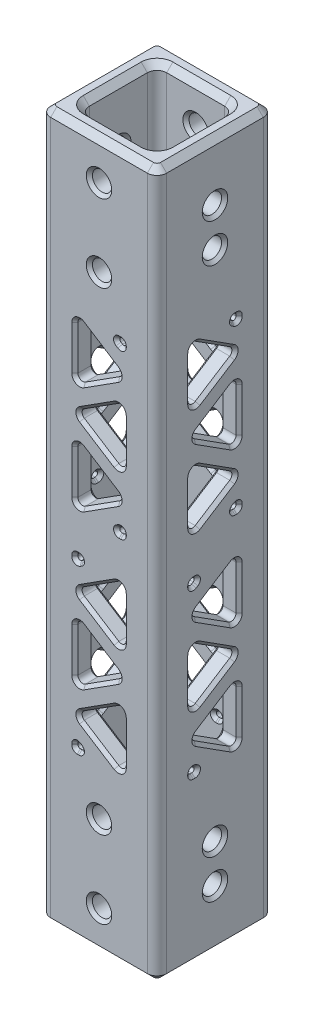
from build123d import *

# Parameters (mm, degrees)
SKETCH1_W                    = 19.05
SKETCH1_H                    = 19.05
SKETCH1_W_2                  = 12.7
SKETCH1_H_2                  = 12.7
BOSS_EXTRUDE1_DEPTH          = 57.94375
F_1_8_0_125_DIAMETER_HOLE1_D = 3.175
F_1_8_0_125_DIAMETER_HOLE2_D = 3.175
F_1_8_0_125_DIAMETER_HOLE3_D = 3.175
CUT_EXTRUDE1_DEPTH           = 60.488901604
CIRPATTERN2_COUNT            = 4
FILLET1_R                    = 1.5875
FILLET2_R                    = 0.79375
FILLET3_R                    = 0.396875
CHAMFER1_SIZE                = 1.016
CHAMFER2_SIZE                = 0.508


with BuildPart() as part:
    # Sketch1 → Boss-Extrude1 (new, symmetric)
    with BuildSketch(Plane(origin=(0, 0, 0), x_dir=(1, 0, 0), z_dir=(0, 1, 0))):
        Rectangle(SKETCH1_W, SKETCH1_H)
        Rectangle(SKETCH1_W_2, SKETCH1_H_2, mode=Mode.SUBTRACT)
    extrude(amount=BOSS_EXTRUDE1_DEPTH, both=True)

    # 1/8 (0.125) Diameter Hole1 (through all)
    with Locations(Plane(origin=(0, 0, 9.525), x_dir=(-1, 0, 0), z_dir=(0, 0, 1))):
        with Locations((0, -51.59375), (0, -38.89375), (0, 38.89375), (0, 51.59375)):
            Hole(F_1_8_0_125_DIAMETER_HOLE1_D / 2)

    # 1/8 (0.125) Diameter Hole2 (through all)
    with Locations(Plane.ZY.offset(9.525)):
        with Locations((0, 48.41875), (0, 42.06875)):
            Hole(F_1_8_0_125_DIAMETER_HOLE2_D / 2)

    # 1/8 (0.125) Diameter Hole3 (through all)
    with Locations(Plane(origin=(9.525, 0, 0), x_dir=(0, 0, -1), z_dir=(1, 0, 0))):
        with Locations((0, -42.06875), (0, -48.41875)):
            Hole(F_1_8_0_125_DIAMETER_HOLE3_D / 2)

    # Sketch14 → Cut-Extrude1 (cut, through all)
    with BuildSketch(Plane.XY):
        Polygon((-3.96875, 30.95625), (-1.935718061, 30.95625), (-3.96875, 29.659612075), align=None)
        Polygon((3.96875, 30.95625), (-3.96875, 25.893829025), (3.96875, 20.83140805), align=None)
        Polygon((-3.96875, 22.128045975), (3.96875, 17.065625), (-3.96875, 12.003204025), align=None)
        Polygon((3.96875, 13.29984195), (-3.96875, 8.237420975), (3.96875, 3.175), align=None)
        Polygon((-1.935718061, 3.175), (-3.96875, 3.175), (-3.96875, 4.471637925), align=None)
        Polygon((1.935718061, -3.175), (3.96875, -3.175), (3.96875, -4.471637925), align=None)
        Polygon((-3.96875, -3.175), (3.96875, -8.237420975), (-3.96875, -13.29984195), align=None)
        Polygon((3.96875, -12.003204025), (-3.96875, -17.065625), (3.96875, -22.128045975), align=None)
        Polygon((-3.96875, -30.95625), (3.96875, -25.893829025), (-3.96875, -20.83140805), align=None)
        Polygon((1.935718061, -30.95625), (3.96875, -30.95625), (3.96875, -29.659612075), align=None)
    cut_extrude1 = extrude(amount=-CUT_EXTRUDE1_DEPTH, mode=Mode.SUBTRACT)

    # CirPattern2: Cut-Extrude1 ×4 about axis
    cirpattern2_axis = Axis((0, 0, 0), (0, 1, 0))
    for i in range(1, CIRPATTERN2_COUNT):
        add(cut_extrude1.rotate(cirpattern2_axis, i * 360 / CIRPATTERN2_COUNT), mode=Mode.SUBTRACT)

    # Fillet1
    fillet1_edges = [part.edges().sort_by_distance(p)[0] for p in [
        (6.35, 0, 6.35),
        (6.35, 0, -6.35),
        (-6.35, 0, -6.35),
        (-6.35, 0, 6.35),
        (9.525, 0, 9.525),
        (-9.525, 0, 9.525),
        (-9.525, 0, -9.525),
        (9.525, 0, -9.525),
    ]]
    fillet(fillet1_edges, radius=FILLET1_R)

    # Fillet2
    fillet2_edges = [part.edges().sort_by_distance(p)[0] for p in [
        (3.96875, 30.95625, -7.9375),
        (3.96875, 20.83140805, -7.9375),
        (-3.96875, 25.893829025, -7.9375),
        (-3.96875, 12.003204025, -7.9375),
        (-3.96875, 22.128045975, -7.9375),
        (3.96875, 17.065625, -7.9375),
        (-3.96875, -13.29984195, -7.9375),
        (-3.96875, -3.175, -7.9375),
        (3.96875, -8.237420975, -7.9375),
        (3.96875, 13.29984195, -7.9375),
        (3.96875, 3.175, -7.9375),
        (-3.96875, 8.237420975, -7.9375),
        (-3.96875, -30.95625, -7.9375),
        (-3.96875, -20.83140805, -7.9375),
        (3.96875, -25.893829025, -7.9375),
        (3.96875, -12.003204025, -7.9375),
        (3.96875, -22.128045975, -7.9375),
        (-3.96875, -17.065625, -7.9375),
        (7.9375, -12.003204025, 3.96875),
        (-7.9375, -13.29984195, 3.96875),
        (7.9375, -13.29984195, -3.96875),
        (7.9375, -30.95625, -3.96875),
        (-7.9375, -12.003204025, -3.96875),
        (-7.9375, -30.95625, 3.96875),
        (7.9375, -22.128045975, 3.96875),
        (7.9375, -17.065625, -3.96875),
        (3.96875, -30.95625, 7.9375),
        (3.96875, -20.83140805, 7.9375),
        (-3.96875, -25.893829025, 7.9375),
        (3.96875, -13.29984195, 7.9375),
        (3.96875, -3.175, 7.9375),
        (-3.96875, -8.237420975, 7.9375),
        (7.9375, -20.83140805, -3.96875),
        (7.9375, -25.893829025, 3.96875),
        (7.9375, -3.175, -3.96875),
        (7.9375, -8.237420975, 3.96875),
        (-3.96875, -12.003204025, 7.9375),
        (-3.96875, -22.128045975, 7.9375),
        (3.96875, -17.065625, 7.9375),
        (-7.9375, -20.83140805, 3.96875),
        (-7.9375, -25.893829025, -3.96875),
        (-7.9375, -22.128045975, -3.96875),
        (-7.9375, -17.065625, 3.96875),
        (-7.9375, -3.175, 3.96875),
        (-7.9375, -8.237420975, -3.96875),
        (7.9375, 12.003204025, -3.96875),
        (-7.9375, 13.29984195, -3.96875),
        (7.9375, 13.29984195, 3.96875),
        (7.9375, 30.95625, 3.96875),
        (-7.9375, 30.95625, -3.96875),
        (-7.9375, 12.003204025, 3.96875),
        (7.9375, 3.175, 3.96875),
        (7.9375, 8.237420975, -3.96875),
        (-3.96875, 13.29984195, 7.9375),
        (-3.96875, 3.175, 7.9375),
        (3.96875, 8.237420975, 7.9375),
        (-3.96875, 30.95625, 7.9375),
        (-3.96875, 20.83140805, 7.9375),
        (3.96875, 25.893829025, 7.9375),
        (-7.9375, 20.83140805, -3.96875),
        (-7.9375, 25.893829025, 3.96875),
        (-7.9375, 22.128045975, 3.96875),
        (-7.9375, 17.065625, -3.96875),
        (3.96875, 12.003204025, 7.9375),
        (3.96875, 22.128045975, 7.9375),
        (-3.96875, 17.065625, 7.9375),
        (7.9375, 20.83140805, 3.96875),
        (7.9375, 25.893829025, -3.96875),
        (7.9375, 22.128045975, -3.96875),
        (7.9375, 17.065625, 3.96875),
        (-7.9375, 3.175, -3.96875),
        (-7.9375, 8.237420975, 3.96875),
    ]]
    fillet(fillet2_edges, radius=FILLET2_R)

    # Fillet3
    fillet3_edges = [part.edges().sort_by_distance(p)[0] for p in [
        (3.96875, -3.175, -7.9375),
        (3.96875, -4.471637925, -7.9375),
        (1.935718061, -3.175, -7.9375),
        (-3.96875, 3.175, -7.9375),
        (-3.96875, 4.471637925, -7.9375),
        (-1.935718061, 3.175, -7.9375),
        (3.96875, -29.659612075, -7.9375),
        (3.96875, -30.95625, -7.9375),
        (1.935718061, -30.95625, -7.9375),
        (-3.96875, 29.659612075, -7.9375),
        (-3.96875, 30.95625, -7.9375),
        (-1.935718061, 30.95625, -7.9375),
        (-7.9375, -29.659612075, -3.96875),
        (7.9375, -29.659612075, 3.96875),
        (7.9375, -30.95625, 1.935718061),
        (7.9375, -30.95625, 3.96875),
        (-7.9375, -3.175, -3.96875),
        (7.9375, -3.175, 3.96875),
        (7.9375, -4.471637925, 3.96875),
        (7.9375, -3.175, 1.935718061),
        (-7.9375, -4.471637925, -3.96875),
        (-7.9375, -3.175, -1.935718061),
        (-7.9375, -30.95625, -3.96875),
        (-7.9375, -30.95625, -1.935718061),
        (-3.96875, -3.175, 7.9375),
        (-3.96875, -4.471637925, 7.9375),
        (-1.935718061, -3.175, 7.9375),
        (-3.96875, -29.659612075, 7.9375),
        (-1.935718061, -30.95625, 7.9375),
        (-3.96875, -30.95625, 7.9375),
        (7.9375, 29.659612075, -3.96875),
        (7.9375, 3.175, -3.96875),
        (7.9375, 30.95625, -3.96875),
        (7.9375, 30.95625, -1.935718061),
        (3.96875, 3.175, 7.9375),
        (3.96875, 4.471637925, 7.9375),
        (1.935718061, 3.175, 7.9375),
        (-7.9375, 29.659612075, 3.96875),
        (-7.9375, 30.95625, 3.96875),
        (-7.9375, 30.95625, 1.935718061),
        (3.96875, 29.659612075, 7.9375),
        (3.96875, 30.95625, 7.9375),
        (1.935718061, 30.95625, 7.9375),
        (-7.9375, 3.175, 3.96875),
        (-7.9375, 4.471637925, 3.96875),
        (-7.9375, 3.175, 1.935718061),
        (7.9375, 4.471637925, -3.96875),
        (7.9375, 3.175, -1.935718061),
    ]]
    fillet(fillet3_edges, radius=FILLET3_R)

    # Chamfer1
    chamfer1_edges = [part.edges().sort_by_distance(p)[0] for p in [
        (0, -57.94375, -9.525),
        (0, 57.94375, -9.525),
        (9.525, -57.94375, 0),
        (0, -57.94375, 9.525),
        (-9.525, -57.94375, 0),
        (0, -57.94375, 6.35),
        (6.35, -57.94375, 0),
        (0, -57.94375, -6.35),
        (-6.35, -57.94375, 0),
        (-9.060032015, -57.94375, 9.060032015),
        (-9.060032015, -57.94375, -9.060032015),
        (9.060032015, -57.94375, 9.060032015),
        (9.060032015, -57.94375, -9.060032015),
        (9.525, 57.94375, 0),
        (-9.525, 57.94375, 0),
        (0, 57.94375, 9.525),
        (6.35, 57.94375, 0),
        (0, 57.94375, 6.35),
        (-6.35, 57.94375, 0),
        (0, 57.94375, -6.35),
        (-9.060032015, 57.94375, 9.060032015),
        (-9.060032015, 57.94375, -9.060032015),
        (9.060032015, 57.94375, 9.060032015),
        (9.060032015, 57.94375, -9.060032015),
        (5.885032015, -57.94375, -5.885032015),
        (5.885032015, 57.94375, -5.885032015),
        (5.885032015, -57.94375, 5.885032015),
        (5.885032015, 57.94375, 5.885032015),
        (-5.885032015, -57.94375, 5.885032015),
        (-5.885032015, 57.94375, 5.885032015),
        (-5.885032015, -57.94375, -5.885032015),
        (-5.885032015, 57.94375, -5.885032015),
    ]]
    chamfer(chamfer1_edges, length=CHAMFER1_SIZE)

    # Chamfer2
    chamfer2_edges = [part.edges().sort_by_distance(p)[0] for p in [
        (9.525, -12.548152991, -3.556607903),
        (6.35, 21.376357017, -3.556607903),
        (9.525, 21.376357017, -3.556607903),
        (6.35, 17.065625, 3.286382985),
        (9.525, 17.065625, 3.286382985),
        (6.35, 12.754892983, -3.556607903),
        (9.525, 12.754892983, -3.556607903),
        (6.35, 21.583097009, 3.556607903),
        (9.525, 21.583097009, 3.556607903),
        (6.35, 30.204561042, 3.556607903),
        (9.525, 30.204561042, 3.556607903),
        (6.35, 25.893829025, -3.286382985),
        (9.525, 25.893829025, -3.286382985),
        (3.556607903, -21.376357017, -6.35),
        (3.556607903, -21.376357017, -9.525),
        (-3.286382985, -17.065625, -6.35),
        (-3.286382985, -17.065625, -9.525),
        (3.556607903, -12.754892983, -6.35),
        (3.556607903, -12.754892983, -9.525),
        (-3.556607903, -21.583097009, -6.35),
        (-3.556607903, -21.583097009, -9.525),
        (3.286382985, -25.893829025, -6.35),
        (3.286382985, -25.893829025, -9.525),
        (-3.556607903, -30.204561042, -6.35),
        (-3.556607903, -30.204561042, -9.525),
        (3.556607903, 3.926688958, -6.35),
        (3.556607903, 3.926688958, -9.525),
        (-3.286382985, 8.237420975, -6.35),
        (-3.286382985, 8.237420975, -9.525),
        (3.556607903, 12.548152991, -6.35),
        (3.556607903, 12.548152991, -9.525),
        (-3.556607903, -3.926688958, -6.35),
        (-3.556607903, -3.926688958, -9.525),
        (3.286382985, -8.237420975, -6.35),
        (3.286382985, -8.237420975, -9.525),
        (-3.556607903, -12.548152991, -6.35),
        (-3.556607903, -12.548152991, -9.525),
        (-3.556607903, 21.376357017, -6.35),
        (-3.556607903, 21.376357017, -9.525),
        (3.286382985, 17.065625, -6.35),
        (3.286382985, 17.065625, -9.525),
        (-3.556607903, 12.754892983, -6.35),
        (-3.556607903, 12.754892983, -9.525),
        (3.556607903, 21.583097009, -6.35),
        (3.556607903, 21.583097009, -9.525),
        (3.556607903, 30.204561042, -6.35),
        (3.556607903, 30.204561042, -9.525),
        (-3.286382985, 25.893829025, -6.35),
        (-3.286382985, 25.893829025, -9.525),
        (-3.433961043, -30.95625, 6.35),
        (-3.433961043, -30.95625, 9.525),
        (-3.220550095, -30.136802991, 6.35),
        (-3.220550095, -30.136802991, 9.525),
        (-3.96875, -30.471415503, 6.35),
        (-3.96875, -30.471415503, 9.525),
        (-3.220550095, -3.994447009, 6.35),
        (-3.220550095, -3.994447009, 9.525),
        (-3.433961043, -3.175, 6.35),
        (-3.433961043, -3.175, 9.525),
        (-3.96875, -3.659834497, 6.35),
        (-3.96875, -3.659834497, 9.525),
        (3.220550095, 3.994447009, 6.35),
        (3.220550095, 3.994447009, 9.525),
        (3.433961043, 3.175, 6.35),
        (3.433961043, 3.175, 9.525),
        (3.96875, 3.659834497, 6.35),
        (3.96875, 3.659834497, 9.525),
        (3.220550095, 30.136802991, 6.35),
        (3.220550095, 30.136802991, 9.525),
        (3.96875, 30.471415503, 6.35),
        (3.96875, 30.471415503, 9.525),
        (3.433961043, 30.95625, 6.35),
        (3.433961043, 30.95625, 9.525),
        (-6.35, -30.95625, -3.433961043),
        (-9.525, -30.95625, -3.433961043),
        (-6.35, -30.136802991, -3.220550095),
        (-9.525, -30.136802991, -3.220550095),
        (-6.35, -30.471415503, -3.96875),
        (-9.525, -30.471415503, -3.96875),
        (-6.35, -3.994447009, -3.220550095),
        (-9.525, -3.994447009, -3.220550095),
        (-6.35, -3.175, -3.433961043),
        (-9.525, -3.175, -3.433961043),
        (-6.35, -3.659834497, -3.96875),
        (-9.525, -3.659834497, -3.96875),
        (-6.35, 3.175, 3.433961043),
        (-9.525, 3.175, 3.433961043),
        (-6.35, 3.659834497, 3.96875),
        (-9.525, 3.659834497, 3.96875),
        (-6.35, 3.994447009, 3.220550095),
        (-9.525, 3.994447009, 3.220550095),
        (-6.35, 30.95625, 3.433961043),
        (-9.525, 30.95625, 3.433961043),
        (-6.35, 30.136802991, 3.220550095),
        (-9.525, 30.136802991, 3.220550095),
        (-6.35, 30.471415503, 3.96875),
        (-9.525, 30.471415503, 3.96875),
        (6.35, 30.95625, -3.433961043),
        (9.525, 30.95625, -3.433961043),
        (6.35, 30.136802991, -3.220550095),
        (9.525, 30.136802991, -3.220550095),
        (6.35, 30.471415503, -3.96875),
        (9.525, 30.471415503, -3.96875),
        (6.35, -30.471415503, 3.96875),
        (9.525, -30.471415503, 3.96875),
        (6.35, -30.95625, 3.433961043),
        (9.525, -30.95625, 3.433961043),
        (6.35, -30.136802991, 3.220550095),
        (9.525, -30.136802991, 3.220550095),
        (6.35, 3.659834497, -3.96875),
        (9.525, 3.659834497, -3.96875),
        (6.35, 3.994447009, -3.220550095),
        (9.525, 3.994447009, -3.220550095),
        (6.35, 3.175, -3.433961043),
        (9.525, 3.175, -3.433961043),
        (6.35, -3.659834497, 3.96875),
        (9.525, -3.659834497, 3.96875),
        (6.35, -3.994447009, 3.220550095),
        (9.525, -3.994447009, 3.220550095),
        (6.35, -3.175, 3.433961043),
        (9.525, -3.175, 3.433961043),
        (-3.433961043, 30.95625, -6.35),
        (-3.433961043, 30.95625, -9.525),
        (-3.220550095, 30.136802991, -6.35),
        (-3.220550095, 30.136802991, -9.525),
        (-3.96875, 30.471415503, -6.35),
        (-3.96875, 30.471415503, -9.525),
        (3.96875, -30.471415503, -6.35),
        (3.96875, -30.471415503, -9.525),
        (3.433961043, -30.95625, -6.35),
        (3.433961043, -30.95625, -9.525),
        (3.220550095, -30.136802991, -6.35),
        (3.220550095, -30.136802991, -9.525),
        (-3.96875, 3.659834497, -6.35),
        (-3.96875, 3.659834497, -9.525),
        (-3.220550095, 3.994447009, -6.35),
        (-3.220550095, 3.994447009, -9.525),
        (-3.433961043, 3.175, -6.35),
        (-3.433961043, 3.175, -9.525),
        (3.96875, -3.659834497, -6.35),
        (3.96875, -3.659834497, -9.525),
        (3.220550095, -3.994447009, -6.35),
        (3.220550095, -3.994447009, -9.525),
        (3.433961043, -3.175, -6.35),
        (3.433961043, -3.175, -9.525),
        (-2.915055546, -30.670529004, 6.35),
        (-2.915055546, -30.670529004, 9.525),
        (-3.762678951, -30.035456554, 6.35),
        (-3.762678951, -30.035456554, 9.525),
        (-3.852508004, -30.840008004, 6.35),
        (-3.852508004, -30.840008004, 9.525),
        (-2.915055546, -3.460720996, 6.35),
        (-2.915055546, -3.460720996, 9.525),
        (-3.762678951, -4.095793446, 6.35),
        (-3.762678951, -4.095793446, 9.525),
        (-3.852508004, -3.291241996, 6.35),
        (-3.852508004, -3.291241996, 9.525),
        (2.915055546, 3.460720996, 6.35),
        (2.915055546, 3.460720996, 9.525),
        (3.762678951, 4.095793446, 6.35),
        (3.762678951, 4.095793446, 9.525),
        (3.852508004, 3.291241996, 6.35),
        (3.852508004, 3.291241996, 9.525),
        (3.762678951, 30.035456554, 6.35),
        (3.762678951, 30.035456554, 9.525),
        (3.852508004, 30.840008004, 6.35),
        (3.852508004, 30.840008004, 9.525),
        (2.915055546, 30.670529004, 6.35),
        (2.915055546, 30.670529004, 9.525),
        (-6.35, -30.670529004, -2.915055546),
        (-9.525, -30.670529004, -2.915055546),
        (-6.35, -30.035456554, -3.762678951),
        (-9.525, -30.035456554, -3.762678951),
        (-6.35, -30.840008004, -3.852508004),
        (-9.525, -30.840008004, -3.852508004),
        (-6.35, -3.460720996, -2.915055546),
        (-9.525, -3.460720996, -2.915055546),
        (-6.35, -4.095793446, -3.762678951),
        (-9.525, -4.095793446, -3.762678951),
        (-6.35, -3.291241996, -3.852508004),
        (-9.525, -3.291241996, -3.852508004),
        (-6.35, 3.291241996, 3.852508004),
        (-9.525, 3.291241996, 3.852508004),
        (-6.35, 4.095793446, 3.762678951),
        (-9.525, 4.095793446, 3.762678951),
        (-6.35, 3.460720996, 2.915055546),
        (-9.525, 3.460720996, 2.915055546),
        (-6.35, 30.670529004, 2.915055546),
        (-9.525, 30.670529004, 2.915055546),
        (-6.35, 30.035456554, 3.762678951),
        (-9.525, 30.035456554, 3.762678951),
        (-6.35, 30.840008004, 3.852508004),
        (-9.525, 30.840008004, 3.852508004),
        (6.35, 30.670529004, -2.915055546),
        (9.525, 30.670529004, -2.915055546),
        (6.35, 30.035456554, -3.762678951),
        (9.525, 30.035456554, -3.762678951),
        (6.35, -30.840008004, 3.852508004),
        (9.525, -30.840008004, 3.852508004),
        (6.35, -30.670529004, 2.915055546),
        (9.525, -30.670529004, 2.915055546),
        (6.35, -30.035456554, 3.762678951),
        (9.525, -30.035456554, 3.762678951),
        (6.35, 4.095793446, -3.762678951),
        (9.525, 4.095793446, -3.762678951),
        (6.35, 3.460720996, -2.915055546),
        (9.525, 3.460720996, -2.915055546),
        (6.35, 3.291241996, -3.852508004),
        (9.525, 3.291241996, -3.852508004),
        (6.35, -4.095793446, 3.762678951),
        (9.525, -4.095793446, 3.762678951),
        (6.35, -3.460720996, 2.915055546),
        (9.525, -3.460720996, 2.915055546),
        (6.35, -3.291241996, 3.852508004),
        (9.525, -3.291241996, 3.852508004),
        (6.35, 30.840008004, -3.852508004),
        (9.525, 30.840008004, -3.852508004),
        (-2.915055546, 30.670529004, -6.35),
        (-2.915055546, 30.670529004, -9.525),
        (-3.762678951, 30.035456554, -6.35),
        (-3.762678951, 30.035456554, -9.525),
        (3.852508004, -30.840008004, -6.35),
        (3.852508004, -30.840008004, -9.525),
        (2.915055546, -30.670529004, -6.35),
        (2.915055546, -30.670529004, -9.525),
        (3.762678951, -30.035456554, -6.35),
        (3.762678951, -30.035456554, -9.525),
        (-3.762678951, 4.095793446, -6.35),
        (-3.762678951, 4.095793446, -9.525),
        (-2.915055546, 3.460720996, -6.35),
        (-2.915055546, 3.460720996, -9.525),
        (-3.852508004, 3.291241996, -6.35),
        (-3.852508004, 3.291241996, -9.525),
        (3.762678951, -4.095793446, -6.35),
        (3.762678951, -4.095793446, -9.525),
        (2.915055546, -3.460720996, -6.35),
        (2.915055546, -3.460720996, -9.525),
        (3.852508004, -3.291241996, -6.35),
        (3.852508004, -3.291241996, -9.525),
        (-3.852508004, 30.840008004, -6.35),
        (-3.852508004, 30.840008004, -9.525),
        (-1.5875, -51.59375, -6.35),
        (-1.5875, -51.59375, 6.35),
        (-1.5875, -51.59375, 9.525),
        (-1.5875, -51.59375, -9.525),
        (-1.5875, -38.89375, -6.35),
        (-1.5875, -38.89375, 6.35),
        (-1.5875, -38.89375, 9.525),
        (-1.5875, -38.89375, -9.525),
        (-1.5875, 38.89375, -6.35),
        (-1.5875, 38.89375, 6.35),
        (-1.5875, 38.89375, 9.525),
        (-1.5875, 38.89375, -9.525),
        (-1.5875, 51.59375, -6.35),
        (-1.5875, 51.59375, 6.35),
        (-1.5875, 51.59375, 9.525),
        (-1.5875, 51.59375, -9.525),
        (6.35, 42.06875, 1.5875),
        (-6.35, 42.06875, 1.5875),
        (-9.525, 42.06875, 1.5875),
        (9.525, 42.06875, 1.5875),
        (6.35, 48.41875, 1.5875),
        (-6.35, 48.41875, 1.5875),
        (-9.525, 48.41875, 1.5875),
        (9.525, 48.41875, 1.5875),
        (-6.35, -23.417237444, -0.085638388),
        (-9.525, -23.417237444, -0.085638388),
        (-6.35, -28.370420606, -0.085638388),
        (-9.525, -28.370420606, -0.085638388),
        (-6.35, -25.893829025, 3.96875),
        (-9.525, -25.893829025, 3.96875),
        (-6.35, -14.589033419, 0.085638388),
        (-9.525, -14.589033419, 0.085638388),
        (-6.35, -17.065625, -3.96875),
        (-9.525, -17.065625, -3.96875),
        (-6.35, -19.542216581, 0.085638388),
        (-9.525, -19.542216581, 0.085638388),
        (-6.35, -10.714012556, -0.085638388),
        (-9.525, -10.714012556, -0.085638388),
        (-6.35, -8.237420975, 3.96875),
        (-9.525, -8.237420975, 3.96875),
        (-6.35, -5.760829394, -0.085638388),
        (-9.525, -5.760829394, -0.085638388),
        (-6.35, 10.714012556, 0.085638388),
        (-9.525, 10.714012556, 0.085638388),
        (-6.35, 8.237420975, -3.96875),
        (-9.525, 8.237420975, -3.96875),
        (-6.35, 5.760829394, 0.085638388),
        (-9.525, 5.760829394, 0.085638388),
        (-6.35, 14.589033419, -0.085638388),
        (-9.525, 14.589033419, -0.085638388),
        (-6.35, 17.065625, 3.96875),
        (-9.525, 17.065625, 3.96875),
        (-6.35, 19.542216581, -0.085638388),
        (-9.525, 19.542216581, -0.085638388),
        (-6.35, 28.370420606, 0.085638388),
        (-9.525, 28.370420606, 0.085638388),
        (-6.35, 25.893829025, -3.96875),
        (-9.525, 25.893829025, -3.96875),
        (-6.35, 23.417237444, 0.085638388),
        (-9.525, 23.417237444, 0.085638388),
        (-0.085638388, -28.370420606, 6.35),
        (-0.085638388, -28.370420606, 9.525),
        (3.96875, -25.893829025, 6.35),
        (3.96875, -25.893829025, 9.525),
        (-0.085638388, -23.417237444, 6.35),
        (-0.085638388, -23.417237444, 9.525),
        (0.085638388, -14.589033419, 6.35),
        (0.085638388, -14.589033419, 9.525),
        (-3.96875, -17.065625, 6.35),
        (-3.96875, -17.065625, 9.525),
        (0.085638388, -19.542216581, 6.35),
        (0.085638388, -19.542216581, 9.525),
        (-0.085638388, -10.714012556, 6.35),
        (-0.085638388, -10.714012556, 9.525),
        (3.96875, -8.237420975, 6.35),
        (3.96875, -8.237420975, 9.525),
        (-0.085638388, -5.760829394, 6.35),
        (-0.085638388, -5.760829394, 9.525),
        (0.085638388, 10.714012556, 6.35),
        (0.085638388, 10.714012556, 9.525),
        (-3.96875, 8.237420975, 6.35),
        (-3.96875, 8.237420975, 9.525),
        (0.085638388, 5.760829394, 6.35),
        (0.085638388, 5.760829394, 9.525),
        (-0.085638388, 19.542216581, 6.35),
        (-0.085638388, 19.542216581, 9.525),
        (-0.085638388, 14.589033419, 6.35),
        (-0.085638388, 14.589033419, 9.525),
        (3.96875, 17.065625, 6.35),
        (3.96875, 17.065625, 9.525),
        (0.085638388, 23.417237444, 6.35),
        (0.085638388, 23.417237444, 9.525),
        (0.085638388, 28.370420606, 6.35),
        (0.085638388, 28.370420606, 9.525),
        (-3.96875, 25.893829025, 6.35),
        (-3.96875, 25.893829025, 9.525),
        (6.35, -17.065625, 3.96875),
        (9.525, -17.065625, 3.96875),
        (6.35, -19.542216581, -0.085638388),
        (9.525, -19.542216581, -0.085638388),
        (6.35, -14.589033419, -0.085638388),
        (9.525, -14.589033419, -0.085638388),
        (6.35, -25.893829025, -3.96875),
        (9.525, -25.893829025, -3.96875),
        (6.35, -23.417237444, 0.085638388),
        (9.525, -23.417237444, 0.085638388),
        (6.35, -28.370420606, 0.085638388),
        (9.525, -28.370420606, 0.085638388),
        (6.35, 8.237420975, 3.96875),
        (9.525, 8.237420975, 3.96875),
        (6.35, 5.760829394, -0.085638388),
        (9.525, 5.760829394, -0.085638388),
        (6.35, 10.714012556, -0.085638388),
        (9.525, 10.714012556, -0.085638388),
        (6.35, -48.41875, -1.5875),
        (-6.35, -48.41875, -1.5875),
        (6.35, -8.237420975, -3.96875),
        (9.525, -8.237420975, -3.96875),
        (-9.525, -48.41875, -1.5875),
        (9.525, -48.41875, -1.5875),
        (6.35, -5.760829394, 0.085638388),
        (9.525, -5.760829394, 0.085638388),
        (6.35, -10.714012556, 0.085638388),
        (9.525, -10.714012556, 0.085638388),
        (6.35, 17.065625, -3.96875),
        (9.525, 17.065625, -3.96875),
        (6.35, 19.542216581, 0.085638388),
        (9.525, 19.542216581, 0.085638388),
        (6.35, 14.589033419, 0.085638388),
        (9.525, 14.589033419, 0.085638388),
        (6.35, 25.893829025, 3.96875),
        (9.525, 25.893829025, 3.96875),
        (6.35, 23.417237444, -0.085638388),
        (9.525, 23.417237444, -0.085638388),
        (6.35, 28.370420606, -0.085638388),
        (9.525, 28.370420606, -0.085638388),
        (3.96875, -17.065625, -6.35),
        (3.96875, -17.065625, -9.525),
        (-0.085638388, -19.542216581, -6.35),
        (-0.085638388, -19.542216581, -9.525),
        (-0.085638388, -14.589033419, -6.35),
        (-0.085638388, -14.589033419, -9.525),
        (-3.96875, -25.893829025, -6.35),
        (-3.96875, -25.893829025, -9.525),
        (0.085638388, -23.417237444, -6.35),
        (0.085638388, -23.417237444, -9.525),
        (0.085638388, -28.370420606, -6.35),
        (0.085638388, -28.370420606, -9.525),
        (3.96875, 8.237420975, -6.35),
        (3.96875, 8.237420975, -9.525),
        (-0.085638388, 5.760829394, -6.35),
        (-0.085638388, 5.760829394, -9.525),
        (-0.085638388, 10.714012556, -6.35),
        (-0.085638388, 10.714012556, -9.525),
        (-3.96875, -8.237420975, -6.35),
        (-3.96875, -8.237420975, -9.525),
        (0.085638388, -5.760829394, -6.35),
        (0.085638388, -5.760829394, -9.525),
        (0.085638388, -10.714012556, -6.35),
        (0.085638388, -10.714012556, -9.525),
        (-3.96875, 17.065625, -6.35),
        (-3.96875, 17.065625, -9.525),
        (0.085638388, 19.542216581, -6.35),
        (0.085638388, 19.542216581, -9.525),
        (0.085638388, 14.589033419, -6.35),
        (0.085638388, 14.589033419, -9.525),
        (3.96875, 25.893829025, -6.35),
        (3.96875, 25.893829025, -9.525),
        (-0.085638388, 23.417237444, -6.35),
        (-0.085638388, 23.417237444, -9.525),
        (-0.085638388, 28.370420606, -6.35),
        (-0.085638388, 28.370420606, -9.525),
        (-6.35, -25.893829025, -3.286382985),
        (-9.525, -25.893829025, -3.286382985),
        (-6.35, -21.583097009, 3.556607903),
        (-9.525, -21.583097009, 3.556607903),
        (-6.35, -30.204561042, 3.556607903),
        (-9.525, -30.204561042, 3.556607903),
        (-6.35, -12.754892983, -3.556607903),
        (-9.525, -12.754892983, -3.556607903),
        (-6.35, -21.376357017, -3.556607903),
        (-9.525, -21.376357017, -3.556607903),
        (-6.35, -17.065625, 3.286382985),
        (-9.525, -17.065625, 3.286382985),
        (-6.35, -12.548152991, 3.556607903),
        (-9.525, -12.548152991, 3.556607903),
        (-6.35, -3.926688958, 3.556607903),
        (-9.525, -3.926688958, 3.556607903),
        (-6.35, -8.237420975, -3.286382985),
        (-9.525, -8.237420975, -3.286382985),
        (-6.35, 12.548152991, -3.556607903),
        (-9.525, 12.548152991, -3.556607903),
        (-6.35, 3.926688958, -3.556607903),
        (-9.525, 3.926688958, -3.556607903),
        (-6.35, 8.237420975, 3.286382985),
        (-9.525, 8.237420975, 3.286382985),
        (-6.35, 12.754892983, 3.556607903),
        (-9.525, 12.754892983, 3.556607903),
        (-6.35, 21.376357017, 3.556607903),
        (-9.525, 21.376357017, 3.556607903),
        (-6.35, 17.065625, -3.286382985),
        (-9.525, 17.065625, -3.286382985),
        (-6.35, 30.204561042, -3.556607903),
        (-9.525, 30.204561042, -3.556607903),
        (-6.35, 21.583097009, -3.556607903),
        (-9.525, 21.583097009, -3.556607903),
        (-6.35, 25.893829025, 3.286382985),
        (-9.525, 25.893829025, 3.286382985),
        (3.556607903, -30.204561042, 6.35),
        (3.556607903, -30.204561042, 9.525),
        (6.35, -42.06875, -1.5875),
        (3.556607903, -21.583097009, 6.35),
        (3.556607903, -21.583097009, 9.525),
        (-6.35, -42.06875, -1.5875),
        (-3.286382985, -25.893829025, 6.35),
        (-3.286382985, -25.893829025, 9.525),
        (-3.556607903, -12.754892983, 6.35),
        (-9.525, -42.06875, -1.5875),
        (-3.556607903, -12.754892983, 9.525),
        (-3.556607903, -21.376357017, 6.35),
        (9.525, -42.06875, -1.5875),
        (-3.556607903, -21.376357017, 9.525),
        (3.286382985, -17.065625, 6.35),
        (3.286382985, -17.065625, 9.525),
        (3.556607903, -12.548152991, 6.35),
        (3.556607903, -12.548152991, 9.525),
        (3.556607903, -3.926688958, 6.35),
        (3.556607903, -3.926688958, 9.525),
        (-3.286382985, -8.237420975, 6.35),
        (-3.286382985, -8.237420975, 9.525),
        (-3.556607903, 12.548152991, 6.35),
        (-3.556607903, 12.548152991, 9.525),
        (-3.556607903, 3.926688958, 6.35),
        (-3.556607903, 3.926688958, 9.525),
        (3.286382985, 8.237420975, 6.35),
        (3.286382985, 8.237420975, 9.525),
        (-3.286382985, 17.065625, 6.35),
        (-3.286382985, 17.065625, 9.525),
        (3.556607903, 12.754892983, 6.35),
        (3.556607903, 12.754892983, 9.525),
        (3.556607903, 21.376357017, 6.35),
        (3.556607903, 21.376357017, 9.525),
        (3.286382985, 25.893829025, 6.35),
        (3.286382985, 25.893829025, 9.525),
        (-3.556607903, 30.204561042, 6.35),
        (-3.556607903, 30.204561042, 9.525),
        (-3.556607903, 21.583097009, 6.35),
        (-3.556607903, 21.583097009, 9.525),
        (6.35, -21.376357017, 3.556607903),
        (9.525, -21.376357017, 3.556607903),
        (6.35, -17.065625, -3.286382985),
        (9.525, -17.065625, -3.286382985),
        (6.35, -12.754892983, 3.556607903),
        (9.525, -12.754892983, 3.556607903),
        (6.35, -21.583097009, -3.556607903),
        (9.525, -21.583097009, -3.556607903),
        (6.35, -25.893829025, 3.286382985),
        (9.525, -25.893829025, 3.286382985),
        (6.35, -30.204561042, -3.556607903),
        (9.525, -30.204561042, -3.556607903),
        (6.35, 3.926688958, 3.556607903),
        (9.525, 3.926688958, 3.556607903),
        (6.35, 8.237420975, -3.286382985),
        (9.525, 8.237420975, -3.286382985),
        (6.35, 12.548152991, 3.556607903),
        (9.525, 12.548152991, 3.556607903),
        (6.35, -3.926688958, -3.556607903),
        (9.525, -3.926688958, -3.556607903),
        (6.35, -8.237420975, 3.286382985),
        (9.525, -8.237420975, 3.286382985),
        (6.35, -12.548152991, -3.556607903),
    ]]
    chamfer(chamfer2_edges, length=CHAMFER2_SIZE)


solid = part.part
